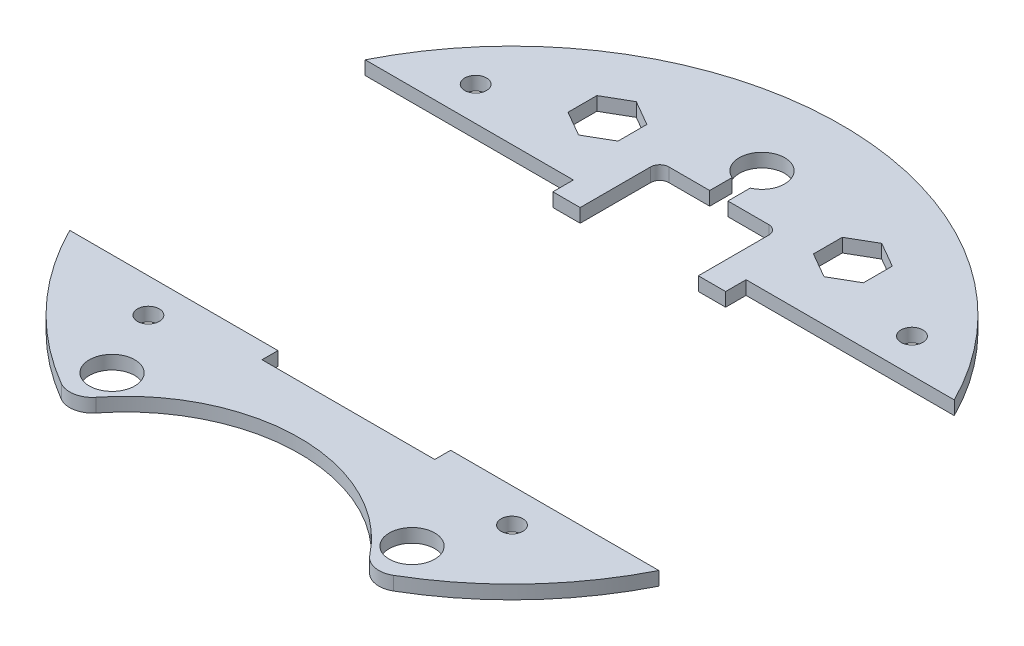
from build123d import *

# Parameters (mm, degrees)
BOSS_EXTRUDE1_DEPTH  = 3
SOLENOID_PLACEMENT_W = 38
SOLENOID_PLACEMENT_H = 64
CUT_EXTRUDE1_DEPTH   = 103.574363269
CUT_EXTRUDE5_DEPTH   = 103.574363269
SKETCH6_R            = 2.4
CUT_EXTRUDE6_DEPTH   = 103.574363269
CUT_EXTRUDE3_DEPTH   = 103.574363269
CUT_EXTRUDE7_DEPTH   = 98.289516393
SKETCH8_R            = 5
CUT_EXTRUDE8_DEPTH   = 98.289516393
CUT_EXTRUDE9_DEPTH   = 98.289516393


with BuildPart() as part:
    # Sketch1 → Boss-Extrude1 (new body)
    with BuildSketch(Plane(origin=(0, 0, 0), x_dir=(1, 0, 0), z_dir=(0, 1, 0))):
        with BuildLine():
            ThreePointArc((36.543377003, -62.616544118), (0, 72.5), (-36.543377003, -62.616544118))
            ThreePointArc((-36.543377003, -62.616544118), (-33.085954668, -63.20954405), (-30.089832649, -61.38507948))
            ThreePointArc((-30.089832649, -61.38507948), (0, -46.75), (30.089832649, -61.38507948))
            ThreePointArc((30.089832649, -61.38507948), (33.085954668, -63.20954405), (36.543377003, -62.616544118))
        make_face()
    extrude(amount=BOSS_EXTRUDE1_DEPTH)

    # solenoid placement → Cut-Extrude1 (cut, through all)
    with BuildSketch(Plane(origin=(0, 3, 0), x_dir=(1, 0, 0), z_dir=(0, 1, 0))):
        with Locations((0, -4)):
            Rectangle(SOLENOID_PLACEMENT_W, SOLENOID_PLACEMENT_H)
    extrude(amount=-CUT_EXTRUDE1_DEPTH, mode=Mode.SUBTRACT)

    # Sketch5 → Cut-Extrude5 (cut, through all)
    with BuildSketch(Plane(origin=(0, 3, 0), x_dir=(1, 0, 0), z_dir=(0, 1, 0))):
        Polygon((-21.5, 51.175426481), (-27, 54.350852961), (-32.5, 51.175426481), (-32.5, 44.824573519), (-27, 41.649147039), (-21.5, 44.824573519), align=None)
        Polygon((21.5, 51.175426481), (21.5, 44.824573519), (27, 41.649147039), (32.5, 44.824573519), (32.5, 51.175426481), (27, 54.350852961), align=None)
    extrude(amount=-CUT_EXTRUDE5_DEPTH, mode=Mode.SUBTRACT)

    # Sketch6 → Cut-Extrude6 (cut, through all)
    with BuildSketch(Plane(origin=(0, 3, 0), x_dir=(1, 0, 0), z_dir=(0, 1, 0))):
        with Locations((48, 40)):
            Circle(SKETCH6_R)
        with Locations((-48, 40)):
            Circle(SKETCH6_R)
        with Locations((40, -40)):
            Circle(SKETCH6_R)
        with Locations((-40, -40)):
            Circle(SKETCH6_R)
    extrude(amount=-CUT_EXTRUDE6_DEPTH, mode=Mode.SUBTRACT)

    # Sketch3 → Cut-Extrude3 (cut, through all)
    with BuildSketch(Plane(origin=(0, 3, 0), x_dir=(1, 0, 0), z_dir=(0, 1, 0))):
        Polygon((-19, 28), (-19, 32.5), (-72.5, 32.5), (-72.5, -32.5), (72.5, -32.5), (72.5, 32.5), (19, 32.5), (19, 28), align=None)
    extrude(amount=-CUT_EXTRUDE3_DEPTH, mode=Mode.SUBTRACT)


with BuildPart() as cut_extrude3_piece_1:
    # of the separate pieces the step leaves, piece 1, a body of its own (cut_extrude3_pieces)
    add(part.part.solids().sort_by_distance((64.807406984, 0, -32.5))[0])

    # Sketch7 → Cut-Extrude7 (cut, through all)
    with BuildSketch(Plane(origin=(0, 3, 0), x_dir=(1, 0, 0), z_dir=(0, 1, 0))):
        with BuildLine():
            Line((13, 28), (13, 43.5))
            ThreePointArc((13, 43.5), (12.414213562, 44.914213562), (11, 45.5))
            Line((11, 45.5), (-11, 45.5))
            ThreePointArc((-11, 45.5), (-12.414213562, 44.914213562), (-13, 43.5))
            Line((-13, 43.5), (-13, 28))
            Line((-13, 28), (13, 28))
        make_face()
    extrude(amount=-CUT_EXTRUDE7_DEPTH, mode=Mode.SUBTRACT)

    # Sketch9 → Cut-Extrude9 (cut, through all)
    with BuildSketch(Plane(origin=(0, 3, 0), x_dir=(1, 0, 0), z_dir=(0, 1, 0))):
        with BuildLine():
            Line((2, 0), (2, 50.417424305))
            ThreePointArc((2, 50.417424305), (0, 60), (-2, 50.417424305))
            Line((-2, 50.417424305), (-2, 0))
            ThreePointArc((-2, 0), (0, -2), (2, 0))
        make_face()
    extrude(amount=-CUT_EXTRUDE9_DEPTH, mode=Mode.SUBTRACT)


with BuildPart() as cut_extrude3_piece_2:
    # of the separate pieces the step leaves, piece 2, a body of its own (cut_extrude3_pieces)
    add(part.part.solids().sort_by_distance((-36.543377003, 0, 62.616544118))[0])

    # Sketch8 → Cut-Extrude8 (cut, through all)
    with BuildSketch(Plane(origin=(0, 3, 0), x_dir=(1, 0, 0), z_dir=(0, 1, 0))):
        with Locations((33, -55)):
            Circle(SKETCH8_R)
        with Locations((-33, -55)):
            Circle(SKETCH8_R)
    extrude(amount=-CUT_EXTRUDE8_DEPTH, mode=Mode.SUBTRACT)


solid = Compound([cut_extrude3_piece_1.part, cut_extrude3_piece_2.part])
